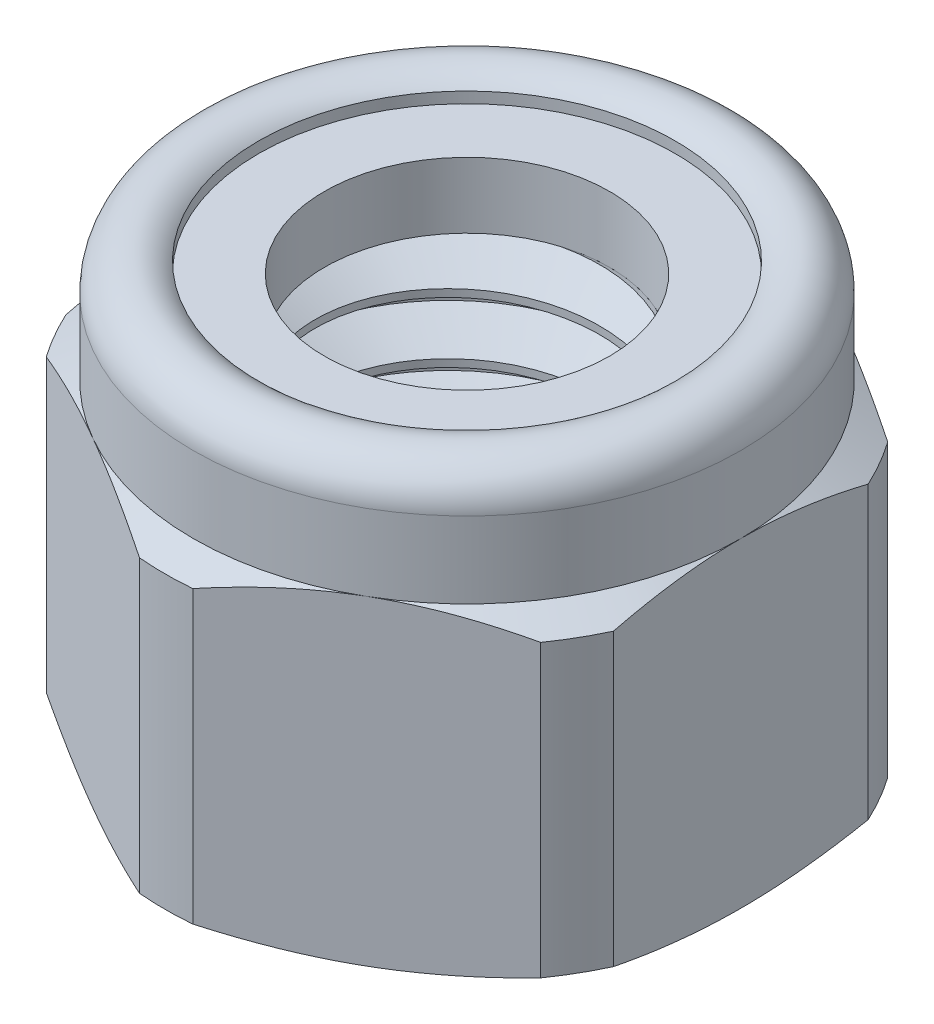
from build123d import *

# Parameters (mm, degrees)
BOSS_EXTRUDE1_DEPTH      = 5.7531
BOSS_EXTRUDE1_DEPTH_BACK = 5.7531
SKETCH2_R                = 3.731388504
SKETCH4_W                = 1.715705748
SKETCH4_H                = 1.719216432
SKETCH11_OUTSIDE_W       = 21.27
SKETCH11_OUTSIDE_H       = 23.486
SKETCH11_OUTSIDE_R       = 7.8994
CUT_EXTRUDE1_DEPTH       = 16.877844618
SKETCH6_W                = 4.7625
SKETCH6_H                = 9.20496
CUT_SWEEP1_PITCH         = 1.5875
SKETCH10_R               = 4.683888504
BOSS_EXTRUDE2_DEPTH      = 9.20496


with BuildPart() as part:
    # Sketch2 → Boss-Extrude1 (new, two sides: drawn at the far end of the back side and taken through both)
    with BuildSketch(Plane(origin=(0, 0, 0), x_dir=(1, 0, 0), z_dir=(0, 1, 0)).offset(-BOSS_EXTRUDE1_DEPTH_BACK)):
        Polygon((0, 8.270889016), (-7.1628, 4.135444508), (-7.1628, -4.135444508), (0, -8.270889016), (7.1628, -4.135444508), (7.1628, 4.135444508), align=None)
        with Locations(Location((0, 0, 0), (0, 0, 270))):
            Circle(SKETCH2_R, mode=Mode.SUBTRACT)
    extrude(amount=BOSS_EXTRUDE1_DEPTH + BOSS_EXTRUDE1_DEPTH_BACK)

    # Sketch3 → Cut-Revolve2 (revolve, cut)
    with BuildSketch(Plane(origin=(0, 0, 0), x_dir=(0, 0, -1), z_dir=(1, 0, 0)), mode=Mode.PRIVATE) as cut_revolve2_sk:
        with BuildLine():
            Line((8.270889016, 2.7559), (8.270889016, 6.7531))
            Line((8.270889016, 6.7531), (3.731388504, 6.7531))
            Line((3.731388504, 6.7531), (3.731388504, 3.45186))
            Line((3.731388504, 3.45186), (5.447094252, 3.45186))
            Line((5.447094252, 3.45186), (5.447094252, 5.458731432))
            ThreePointArc((5.447094252, 5.458731432), (6.542373911, 5.676596102), (7.1628, 4.748062842))
            Line((7.1628, 4.748062842), (7.1628, 2.7559))
            Line((7.1628, 2.7559), (8.270889016, 2.105586866))
            Line((8.270889016, 2.105586866), (8.270889016, 2.7559))
        make_face()
        Polygon((6.876288, -5.7531), (8.270889016, -5.102786866), (8.270889016, -5.7531), align=None)
        Polygon((3.731388504, -5.7531), (3.731388504, -4.8006), (4.683888504, -5.7531), align=None)
    revolve(cut_revolve2_sk.sketch.rotate(Axis((0, -5.7531, 0), (0, 1, 0)), 270), axis=Axis((0, -5.7531, 0), (0, 1, 0)), mode=Mode.SUBTRACT)

    # Sketch11 outside → Cut-Extrude1 (cut, through all)
    with BuildSketch(Plane.XZ.offset(5.7531)):
        Rectangle(SKETCH11_OUTSIDE_W, SKETCH11_OUTSIDE_H)
        Circle(SKETCH11_OUTSIDE_R, mode=Mode.SUBTRACT)
    extrude(amount=-CUT_EXTRUDE1_DEPTH, mode=Mode.SUBTRACT)

    # Sketch10 → Boss-Extrude2 (add)
    with BuildSketch(Plane.XZ.offset(5.7531)):
        Circle(SKETCH10_R)
    extrude(amount=-BOSS_EXTRUDE2_DEPTH)


with BuildPart() as body_2:
    # Sketch4 → Revolve1 (revolve)
    with BuildSketch(Plane(origin=(0, 0, 0), x_dir=(0, 0, -1), z_dir=(1, 0, 0)), mode=Mode.PRIVATE) as revolve1_sk:
        with Locations((-4.589241378, 4.311468216)):
            Rectangle(SKETCH4_W, SKETCH4_H)
    revolve(revolve1_sk.sketch.rotate(Axis((0, -5.7531, 0), (0, 1, 0)), 90), axis=Axis((0, -5.7531, 0), (0, 1, 0)))


with BuildPart() as body_3:
    # Sketch6 → Revolve2 (revolve)
    with BuildSketch(Plane.XY, mode=Mode.PRIVATE) as revolve2_sk:
        with Locations((2.38125, -1.15062)):
            Rectangle(SKETCH6_W, SKETCH6_H)
    revolve(revolve2_sk.sketch.rotate(Axis((0, -5.7531, 0), (0, 1, 0)), 90), axis=Axis((0, -5.7531, 0), (0, 1, 0)))

    # Cut-Sweep1: the profile of Sketch8 profile screwed along a right-hand helix of 7.248 turns, 8 arcs to a turn; built about Z, then put on its axis
    cut_sweep1_z = Axis((0, 0, 0), (0, 0, 1))
    cut_sweep1_corners = [(3.731088504, 0, -0.595485705), (3.731088504, 0, -0.793576795), (4.848425958, 0, -1.438671875), (4.934351916, 0, 0.09921875)]
    with BuildLine(mode=Mode.PRIVATE) as cut_sweep1_profile:
        Line(cut_sweep1_corners[0], cut_sweep1_corners[1])
        Line(cut_sweep1_corners[1], cut_sweep1_corners[2])
        Line(cut_sweep1_corners[2], cut_sweep1_corners[3])
        Line(cut_sweep1_corners[3], cut_sweep1_corners[0])
    cut_sweep1_cap = Face(cut_sweep1_profile.wire())
    cut_sweep1_turn_angles = [0, 22.5, 45, 67.5, 90, 112.5, 135, 157.5, 180, 202.5, 225, 247.5, 270, 292.5, 315, 337.5, 360]
    cut_sweep1_turn_weights = [1, 0.9238795325112867, 1, 0.9238795325112867, 1, 0.9238795325112867, 1, 0.9238795325112867, 1, 0.9238795325112867, 1, 0.9238795325112867, 1, 0.9238795325112867, 1, 0.9238795325112867, 1]
    cut_sweep1_turn_rails = [Edge.make_bspline([Vector(p[0], p[1], 0).rotate(cut_sweep1_z, cut_sweep1_turn_angles[k]) / cut_sweep1_turn_weights[k] + Vector(0, 0, p[2] + CUT_SWEEP1_PITCH * cut_sweep1_turn_angles[k] / 360) for k in range(17)], [0, 0, 0, 1, 1, 2, 2, 3, 3, 4, 4, 5, 5, 6, 6, 7, 7, 8, 8, 8], 2, cut_sweep1_turn_weights) for p in cut_sweep1_corners]
    cut_sweep1_turn_sides = [Face.make_surface_from_curves(cut_sweep1_turn_rails[p[0]], cut_sweep1_turn_rails[p[1]]) for p in [(0, 1), (1, 2), (2, 3), (3, 0)]]
    cut_sweep1_last_angles = [2520, 2542.5, 2565, 2587.14, 2609.28]
    cut_sweep1_last_weights = [1, 0.9238795325112867, 1, 0.9262657510190495, 1]
    cut_sweep1_last_rails = [Edge.make_bspline([Vector(p[0], p[1], 0).rotate(cut_sweep1_z, cut_sweep1_last_angles[k]) / cut_sweep1_last_weights[k] + Vector(0, 0, p[2] + CUT_SWEEP1_PITCH * cut_sweep1_last_angles[k] / 360) for k in range(5)], [0, 0, 0, 1, 1, 2, 2, 2], 2, cut_sweep1_last_weights) for p in cut_sweep1_corners]
    cut_sweep1_last_sides = [Face.make_surface_from_curves(cut_sweep1_last_rails[p[0]], cut_sweep1_last_rails[p[1]]) for p in [(0, 1), (1, 2), (2, 3), (3, 0)]]
    cut_sweep1 = Plane(origin=(0, -5.7531, 0), x_dir=(1, 0, 0), z_dir=(0, 1, 0)) * Solid(Shell([*[p.moved(Location((0, 0, CUT_SWEEP1_PITCH * i))) for i in range(7) for p in cut_sweep1_turn_sides], *cut_sweep1_last_sides, cut_sweep1_cap, cut_sweep1_cap.rotate(cut_sweep1_z, 2609.28).moved(Location((0, 0, CUT_SWEEP1_PITCH * 2609.28 / 360)))]))
    add(cut_sweep1, mode=Mode.SUBTRACT)

    # Sketch9 → Revolve3 (revolve)
    with BuildSketch(Plane.XY, mode=Mode.PRIVATE) as revolve3_sk:
        Polygon((0, -0.9906), (0, -5.7531), (4.7625, -5.7531), (5.715, -5.7531), (0, -0.0381), align=None)
    revolve(revolve3_sk.sketch.rotate(Axis((0, -0.9906, 0), (0, -1, 0)), 90.182506618), axis=Axis((0, -0.9906, 0), (0, -1, 0)))


with BuildPart() as part_1:
    add(part.part)

    # Combine1: cut body 3
    add(body_3.part, mode=Mode.SUBTRACT)


solid = Compound([body_2.part, part_1.part])
